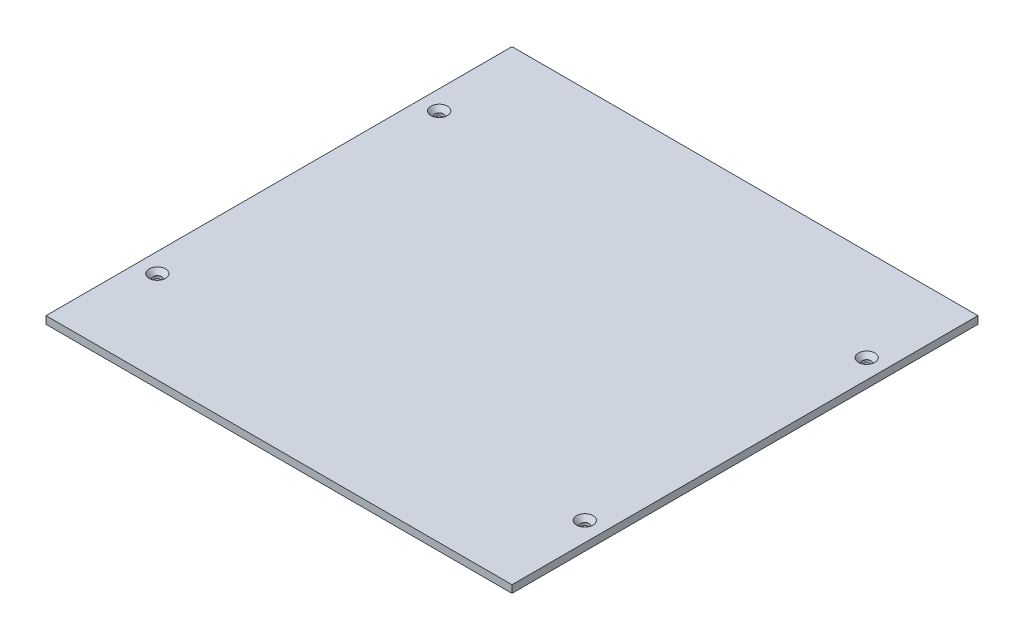
from build123d import *

# Parameters (mm, degrees)
SKETCH1_W                                     = 99.2004
SKETCH1_H                                     = 99.2004
BOSS_EXTRUDE1_DEPTH                           = 1.6002
CSK_FOR_0_FLAT_HEAD_SOCKET_CAP_SCREW1_A_COUNT = 2
CSK_FOR_0_FLAT_HEAD_SOCKET_CAP_SCREW1_A_PITCH = 60
CSK_FOR_0_FLAT_HEAD_SOCKET_CAP_SCRE_2_COUNT   = 2
CSK_FOR_0_FLAT_HEAD_SOCKET_CAP_SCRE_2_PITCH   = 109
CSK_FOR_0_FLAT_HEAD_SOCKET_CAP_SCRE_3_COUNT   = 2
CSK_FOR_0_FLAT_HEAD_SOCKET_CAP_SCRE_3_PITCH   = 91


with BuildPart() as part:
    # Sketch1 → Boss-Extrude1 (new body)
    with BuildSketch(Plane(origin=(0, 0, 0), x_dir=(1, 0, 0), z_dir=(0, 1, 0))):
        with Locations((49.6002, 49.6002)):
            Rectangle(SKETCH1_W, SKETCH1_H)
    extrude(amount=BOSS_EXTRUDE1_DEPTH)

    # Sketch5 → CSK for #0 Flat Head Socket Cap Screw1 (revolve, cut)
    with BuildSketch(Plane(origin=(4.1002, 1.6002, -79.6002), x_dir=(0, 0, 1), z_dir=(1, 0, 0))):
        Polygon((0, 0), (0, 1.6002), (0.889, 1.6002), (0.889, 0.993458156), (1.7526, 0), align=None)
    csk_for_0_flat_head_socket_cap_screw1 = revolve(axis=Axis((4.1002, 7.9502, -79.6002), (0, -1, 0)), mode=Mode.SUBTRACT)

    # CSK for #0 Flat Head Socket Cap Screw1 a: CSK for #0 Flat Head Socket Cap Screw1 ×2
    with Locations(*[(0, 0, i * CSK_FOR_0_FLAT_HEAD_SOCKET_CAP_SCREW1_A_PITCH) for i in range(1, CSK_FOR_0_FLAT_HEAD_SOCKET_CAP_SCREW1_A_COUNT)]):
        add(csk_for_0_flat_head_socket_cap_screw1, mode=Mode.SUBTRACT)

    # CSK for _0 Flat Head Socket Cap Scre 2: CSK for #0 Flat Head Socket Cap Screw1 ×2
    with Locations(*[Vector(0.8348623853211011, 0, 0.5504587155963301) * (i * CSK_FOR_0_FLAT_HEAD_SOCKET_CAP_SCRE_2_PITCH) for i in range(1, CSK_FOR_0_FLAT_HEAD_SOCKET_CAP_SCRE_2_COUNT)]):
        add(csk_for_0_flat_head_socket_cap_screw1, mode=Mode.SUBTRACT)

    # CSK for _0 Flat Head Socket Cap Scre 3: CSK for #0 Flat Head Socket Cap Screw1 ×2
    with Locations(*[(i * CSK_FOR_0_FLAT_HEAD_SOCKET_CAP_SCRE_3_PITCH, 0, 0) for i in range(1, CSK_FOR_0_FLAT_HEAD_SOCKET_CAP_SCRE_3_COUNT)]):
        add(csk_for_0_flat_head_socket_cap_screw1, mode=Mode.SUBTRACT)


solid = part.part
